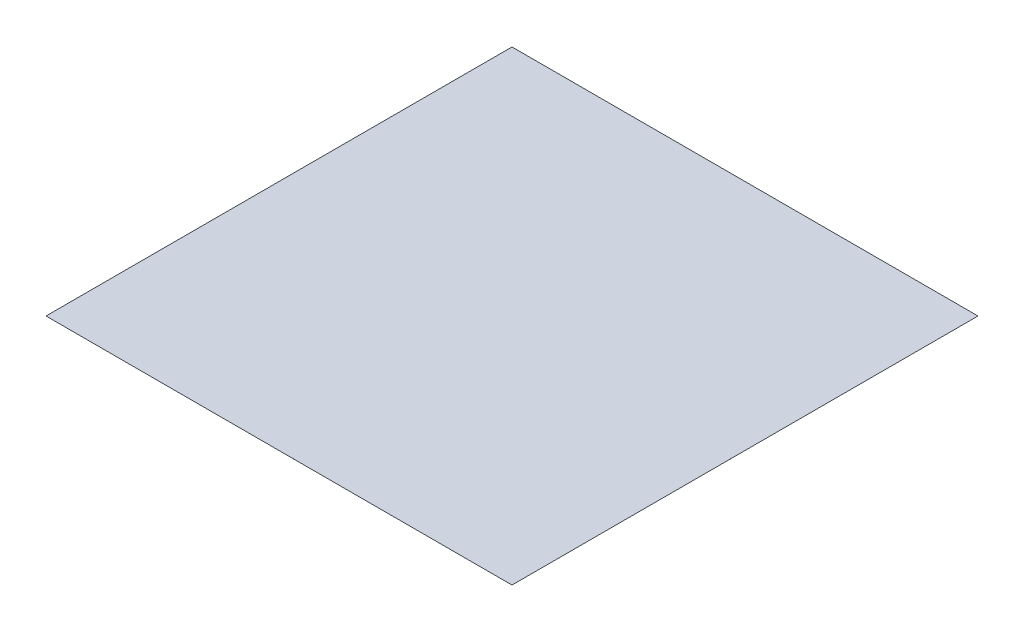
from build123d import *

# Parameters (mm, degrees)
SKETCH1_W           = 5568
SKETCH1_H           = 5568
BOSS_EXTRUDE1_DEPTH = 0.0045


with BuildPart() as part:
    # Sketch1 → Boss-Extrude1 (new body)
    with BuildSketch(Plane(origin=(0, 0, 0), x_dir=(1, 0, 0), z_dir=(0, 1, 0))):
        Rectangle(SKETCH1_W, SKETCH1_H)
    extrude(amount=BOSS_EXTRUDE1_DEPTH)


solid = part.part
